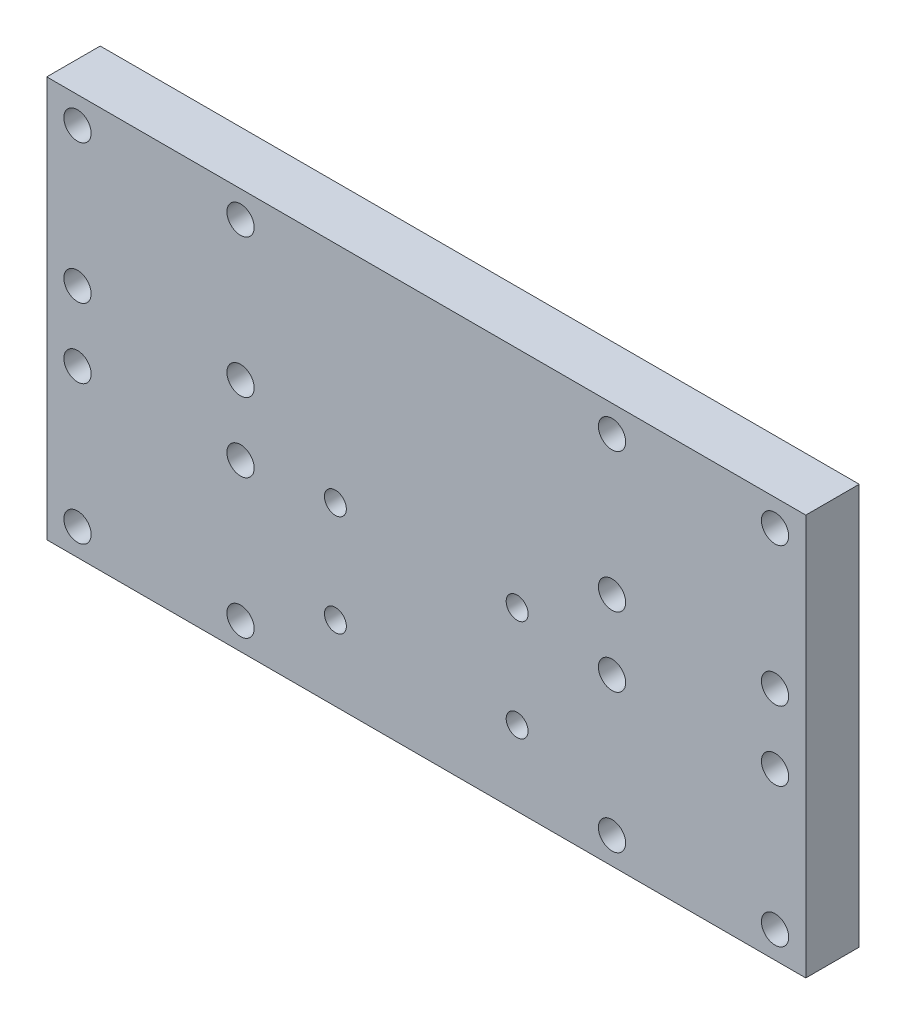
from build123d import *

# Parameters (mm, degrees)
SKETCH1_W           = 142
SKETCH1_H           = 75
BOSS_EXTRUDE1_DEPTH = 5
SKETCH2_R           = 2.55
CUT_EXTRUDE1_DEPTH  = 81.915078941
SKETCH3_R           = 2.05
CUT_EXTRUDE2_DEPTH  = 81.915078941


with BuildPart() as part:
    # Sketch1 → Boss-Extrude1 (new, symmetric)
    with BuildSketch(Plane.XY):
        Rectangle(SKETCH1_W, SKETCH1_H)
    extrude(amount=BOSS_EXTRUDE1_DEPTH, both=True)

    # Sketch2 → Cut-Extrude1 (cut, through all)
    with BuildSketch(Plane.XY.offset(5)):
        with Locations((-65.25, 32.5)):
            Circle(SKETCH2_R)
        with Locations((-34.75, 32.5)):
            Circle(SKETCH2_R)
        with Locations((-34.75, 6.5)):
            Circle(SKETCH2_R)
        with Locations((-65.25, 6.5)):
            Circle(SKETCH2_R)
        with Locations((65.25, 32.5)):
            Circle(SKETCH2_R)
        with Locations((65.25, 6.5)):
            Circle(SKETCH2_R)
        with Locations((34.75, 6.5)):
            Circle(SKETCH2_R)
        with Locations((34.75, 32.5)):
            Circle(SKETCH2_R)
        with Locations((-65.25, -6.5)):
            Circle(SKETCH2_R)
        with Locations((-34.75, -6.5)):
            Circle(SKETCH2_R)
        with Locations((-34.75, -32.5)):
            Circle(SKETCH2_R)
        with Locations((-65.25, -32.5)):
            Circle(SKETCH2_R)
        with Locations((34.75, -6.5)):
            Circle(SKETCH2_R)
        with Locations((65.25, -6.5)):
            Circle(SKETCH2_R)
        with Locations((65.25, -32.5)):
            Circle(SKETCH2_R)
        with Locations((34.75, -32.5)):
            Circle(SKETCH2_R)
    extrude(amount=-CUT_EXTRUDE1_DEPTH, mode=Mode.SUBTRACT)

    # Sketch3 → Cut-Extrude2 (cut, through all)
    with BuildSketch(Plane.XY.offset(5)):
        with Locations((-17, -4.5)):
            Circle(SKETCH3_R)
        with Locations((-17, -23.5)):
            Circle(SKETCH3_R)
        with Locations((17, -23.5)):
            Circle(SKETCH3_R)
        with Locations((17, -4.5)):
            Circle(SKETCH3_R)
    extrude(amount=-CUT_EXTRUDE2_DEPTH, mode=Mode.SUBTRACT)


solid = part.part
